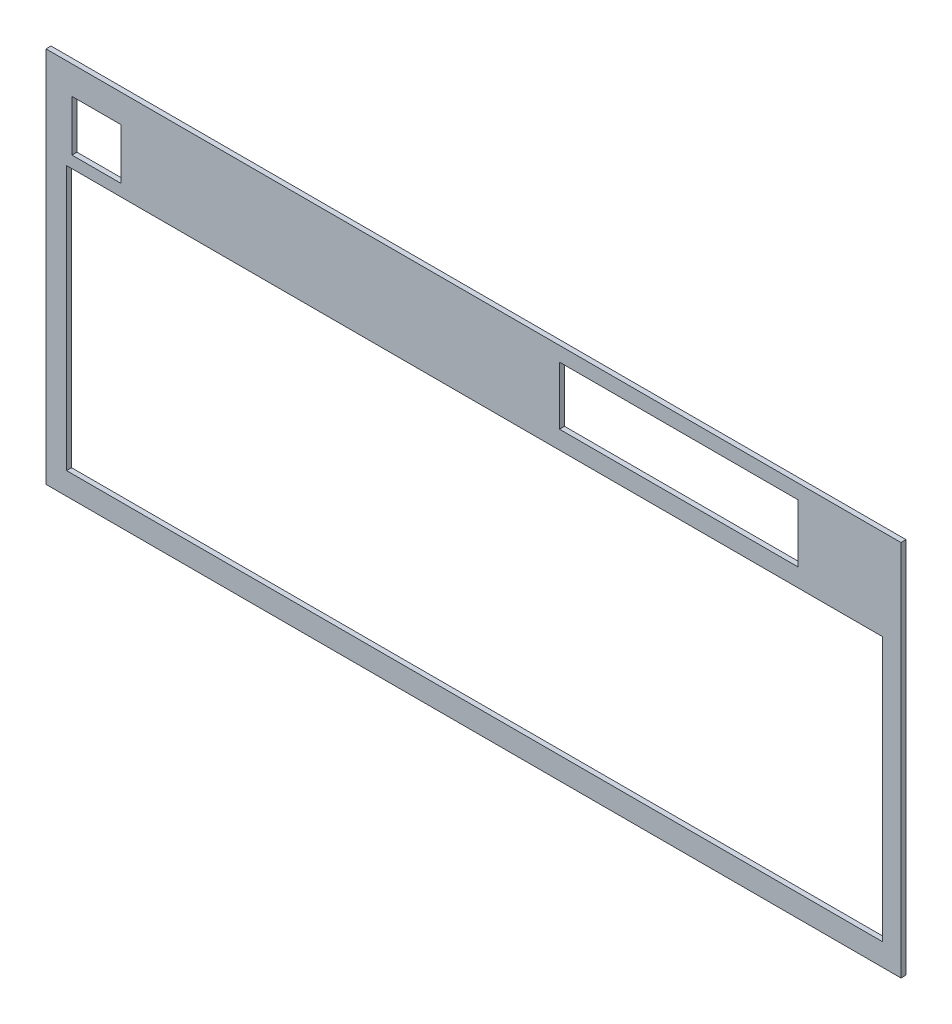
from build123d import *

# Parameters (mm, degrees)
SKETCH1_W           = 19.493677358
SKETCH1_H           = 20.215665408
SKETCH1_W_2         = 324.496448076
SKETCH1_H_2         = 105.049261318
SKETCH1_W_3         = 94.941428614
SKETCH1_H_3         = 23.10361761
BOSS_EXTRUDE1_DEPTH = 2


with BuildPart() as part:
    # Sketch1 → Boss-Extrude1 (new body)
    with BuildSketch(Plane.XY):
        Polygon((-65.357933185, 80.138200046), (268.642737376, 80.138200046), (271.63004243, 80.138200046), (271.63004243, -69.836699624), (268.642737376, -69.836699624), (-68.34523824, -69.836699624), (-68.34523824, 80.138200046), align=None)
        with Locations((-48.281332052, 58.845495167)):
            Rectangle(SKETCH1_W, SKETCH1_H, mode=Mode.SUBTRACT)
        with Locations((102.054089157, -8.479890523)):
            Rectangle(SKETCH1_W_2, SKETCH1_H_2, mode=Mode.SUBTRACT)
        with Locations((183.296335081, 62.816429444)):
            Rectangle(SKETCH1_W_3, SKETCH1_H_3, mode=Mode.SUBTRACT)
    extrude(amount=BOSS_EXTRUDE1_DEPTH)


solid = part.part
